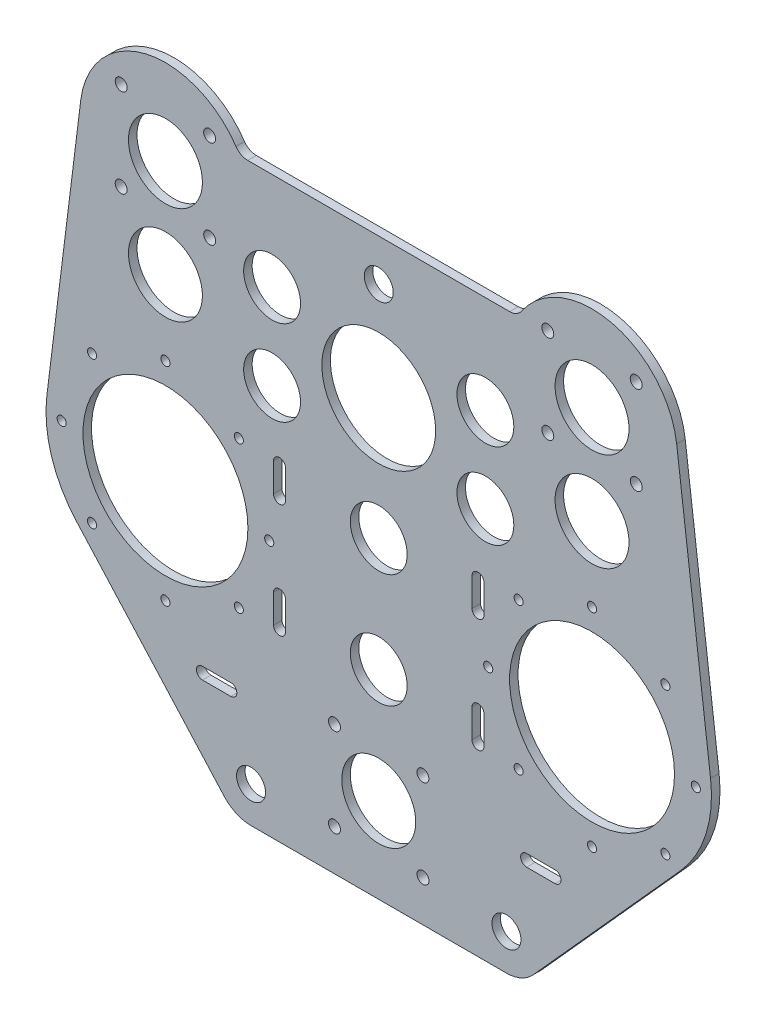
from build123d import *

# Parameters (mm, degrees)
MODEL_R             = 13
MODEL_R_2           = 5.1
MODEL_R_3           = 10
MODEL_R_4           = 20
MODEL_R_5           = 29
MODEL_R_6           = 1.6
MODEL_R_7           = 2.1
BOSS_EXTRUDE1_DEPTH = 3


with BuildPart() as part:
    # Model → Boss-Extrude1 (new body)
    with BuildSketch(Plane.XY):
        with BuildLine():
            Line((-44.9, -110), (0, -110))
            Line((0, -110), (44.9, -110))
            ThreePointArc((44.9, -110), (50.059264201, -108.902545418), (54.325169295, -105.800212848))
            Line((54.325169295, -105.800212848), (106.229152519, -48.084515893))
            ThreePointArc((106.229152519, -48.084515893), (115.069026633, -32.588610118), (116.679519982, -14.821427412))
            Line((116.679519982, -14.821427412), (104.771085702, 81.023096559))
            ThreePointArc((104.771085702, 81.023096559), (82.034748438, 106.48766041), (50.189310486, 94.189159448))
            ThreePointArc((50.189310486, 94.189159448), (48.393618278, 92.581052005), (46.054195567, 92))
            Line((46.054195567, 92), (0, 92))
            Line((0, 92), (-46.054195567, 92))
            ThreePointArc((-46.054195567, 92), (-48.393618278, 92.581052005), (-50.189310486, 94.189159448))
            ThreePointArc((-50.189310486, 94.189159448), (-82.034748438, 106.48766041), (-104.771085702, 81.023096559))
            Line((-104.771085702, 81.023096559), (-116.679519982, -14.821427412))
            ThreePointArc((-116.679519982, -14.821427412), (-115.069026633, -32.588610118), (-106.229152519, -48.084515893))
            Line((-106.229152519, -48.084515893), (-54.325169295, -105.800212848))
            ThreePointArc((-54.325169295, -105.800212848), (-50.059264201, -108.902545418), (-44.9, -110))
        make_face()
        with Locations((0, -80)):
            Circle(MODEL_R, mode=Mode.SUBTRACT)
        with Locations((-44.9, -97.324116139)):
            Circle(MODEL_R_2, mode=Mode.SUBTRACT)
        with Locations((44.9, -97.324116139)):
            Circle(MODEL_R_2, mode=Mode.SUBTRACT)
        with Locations((0, 77.324116139)):
            Circle(MODEL_R_2, mode=Mode.SUBTRACT)
        Circle(MODEL_R_3, mode=Mode.SUBTRACT)
        with Locations((0, -40)):
            Circle(MODEL_R_3, mode=Mode.SUBTRACT)
        with Locations((0, 42.675883861)):
            Circle(MODEL_R_4, mode=Mode.SUBTRACT)
        with Locations((-37.5, 57.675883861)):
            Circle(MODEL_R_3, mode=Mode.SUBTRACT)
        with Locations((-37.5, 27.675883861)):
            Circle(MODEL_R_3, mode=Mode.SUBTRACT)
        with Locations((37.5, 57.675883861)):
            Circle(MODEL_R_3, mode=Mode.SUBTRACT)
        with Locations((37.5, 27.675883861)):
            Circle(MODEL_R_3, mode=Mode.SUBTRACT)
        with Locations((-75, -20)):
            Circle(MODEL_R_5, mode=Mode.SUBTRACT)
        with Locations((-75, 16.5)):
            Circle(MODEL_R_6, mode=Mode.SUBTRACT)
        with Locations((-100.809397513, 5.809397513)):
            Circle(MODEL_R_6, mode=Mode.SUBTRACT)
        with Locations((-49.190602487, 5.809397513)):
            Circle(MODEL_R_6, mode=Mode.SUBTRACT)
        with Locations((-38.5, -20)):
            Circle(MODEL_R_6, mode=Mode.SUBTRACT)
        with Locations((-49.190602487, -45.809397513)):
            Circle(MODEL_R_6, mode=Mode.SUBTRACT)
        with Locations((-75, -56.5)):
            Circle(MODEL_R_6, mode=Mode.SUBTRACT)
        with Locations((-100.809397513, -45.809397513)):
            Circle(MODEL_R_6, mode=Mode.SUBTRACT)
        with Locations((-111.5, -20)):
            Circle(MODEL_R_6, mode=Mode.SUBTRACT)
        with Locations((75, -20)):
            Circle(MODEL_R_5, mode=Mode.SUBTRACT)
        with Locations((75, 16.5)):
            Circle(MODEL_R_6, mode=Mode.SUBTRACT)
        with Locations((49.190602487, 5.809397513)):
            Circle(MODEL_R_6, mode=Mode.SUBTRACT)
        with Locations((100.809397513, 5.809397513)):
            Circle(MODEL_R_6, mode=Mode.SUBTRACT)
        with Locations((111.5, -20)):
            Circle(MODEL_R_6, mode=Mode.SUBTRACT)
        with Locations((100.809397513, -45.809397513)):
            Circle(MODEL_R_6, mode=Mode.SUBTRACT)
        with Locations((75, -56.5)):
            Circle(MODEL_R_6, mode=Mode.SUBTRACT)
        with Locations((49.190602487, -45.809397513)):
            Circle(MODEL_R_6, mode=Mode.SUBTRACT)
        with Locations((38.5, -20)):
            Circle(MODEL_R_6, mode=Mode.SUBTRACT)
        with Locations((-75, 77.324116139)):
            Circle(MODEL_R, mode=Mode.SUBTRACT)
        with Locations((75, 77.324116139)):
            Circle(MODEL_R, mode=Mode.SUBTRACT)
        with Locations((-75, 42.801273872)):
            Circle(MODEL_R, mode=Mode.SUBTRACT)
        with Locations((75, 42.675883861)):
            Circle(MODEL_R, mode=Mode.SUBTRACT)
        with Locations((-59.467622393, 92.856493746)):
            Circle(MODEL_R_7, mode=Mode.SUBTRACT)
        with Locations((-90.556349186, 92.880465325)):
            Circle(MODEL_R_7, mode=Mode.SUBTRACT)
        with Locations((-90.556349186, 61.767766953)):
            Circle(MODEL_R_7, mode=Mode.SUBTRACT)
        with Locations((-59.443650814, 61.767766953)):
            Circle(MODEL_R_7, mode=Mode.SUBTRACT)
        with Locations((90.532377607, 92.856493746)):
            Circle(MODEL_R_7, mode=Mode.SUBTRACT)
        with Locations((59.443650814, 92.880465325)):
            Circle(MODEL_R_7, mode=Mode.SUBTRACT)
        with Locations((59.443650814, 61.767766953)):
            Circle(MODEL_R_7, mode=Mode.SUBTRACT)
        with Locations((90.556349186, 61.767766953)):
            Circle(MODEL_R_7, mode=Mode.SUBTRACT)
        with Locations((15.532377607, -64.467622393)):
            Circle(MODEL_R_7, mode=Mode.SUBTRACT)
        with Locations((-15.556349186, -64.443650814)):
            Circle(MODEL_R_7, mode=Mode.SUBTRACT)
        with Locations((-15.556349186, -95.556349186)):
            Circle(MODEL_R_7, mode=Mode.SUBTRACT)
        with Locations((15.556349186, -95.556349186)):
            Circle(MODEL_R_7, mode=Mode.SUBTRACT)
        with BuildLine():
            Line((-37, 5), (-37, -5))
            ThreePointArc((-37, -5), (-34.9, -7.1), (-32.8, -5))
            Line((-32.8, -5), (-32.8, 5))
            ThreePointArc((-32.8, 5), (-34.9, 7.1), (-37, 5))
        make_face(mode=Mode.SUBTRACT)
        with BuildLine():
            Line((-37, -35), (-37, -45))
            ThreePointArc((-37, -45), (-34.9, -47.1), (-32.8, -45))
            Line((-32.8, -45), (-32.8, -35))
            ThreePointArc((-32.8, -35), (-34.9, -32.9), (-37, -35))
        make_face(mode=Mode.SUBTRACT)
        with BuildLine():
            Line((37, 5), (37, -5))
            ThreePointArc((37, -5), (34.9, -7.1), (32.8, -5))
            Line((32.8, -5), (32.8, 5))
            ThreePointArc((32.8, 5), (34.9, 7.1), (37, 5))
        make_face(mode=Mode.SUBTRACT)
        with BuildLine():
            Line((37, -35), (37, -45))
            ThreePointArc((37, -45), (34.9, -47.1), (32.8, -45))
            Line((32.8, -45), (32.8, -35))
            ThreePointArc((32.8, -35), (34.9, -32.9), (37, -35))
        make_face(mode=Mode.SUBTRACT)
        with BuildLine():
            Line((-62, -70), (-52, -70))
            ThreePointArc((-52, -70), (-49.9, -72.1), (-52, -74.2))
            Line((-52, -74.2), (-62, -74.2))
            ThreePointArc((-62, -74.2), (-64.1, -72.1), (-62, -70))
        make_face(mode=Mode.SUBTRACT)
        with BuildLine():
            Line((62, -70), (52, -70))
            ThreePointArc((52, -70), (49.9, -72.1), (52, -74.2))
            Line((52, -74.2), (62, -74.2))
            ThreePointArc((62, -74.2), (64.1, -72.1), (62, -70))
        make_face(mode=Mode.SUBTRACT)
    extrude(amount=BOSS_EXTRUDE1_DEPTH)


solid = part.part
